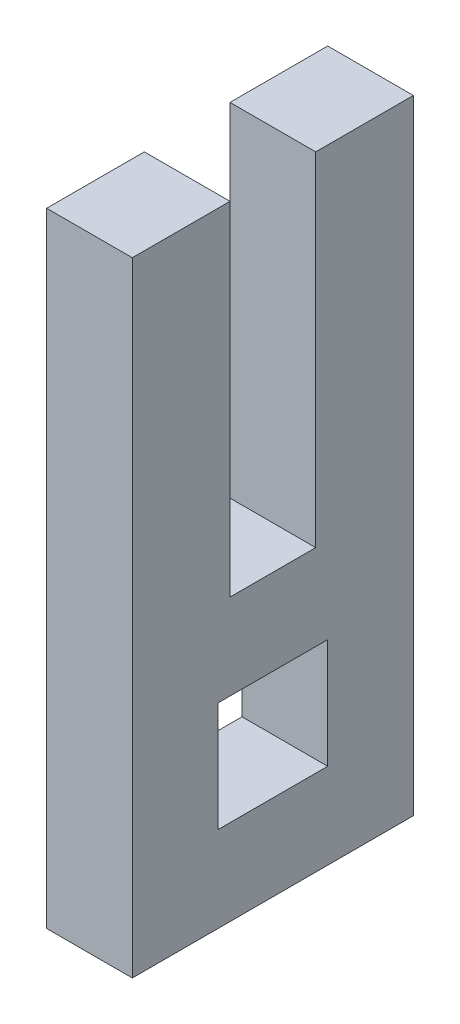
from build123d import *

# Parameters (mm, degrees)
SKETCH2_W           = 8.128
SKETCH2_H           = 8.128
BOSS_EXTRUDE1_DEPTH = 6.35


with BuildPart() as part:
    # Sketch2 → Boss-Extrude1 (new body)
    with BuildSketch(Plane(origin=(0, 0, 0), x_dir=(0, 0, -1), z_dir=(1, 0, 0))):
        Polygon((0, 0), (0, 46.228), (7.239, 46.228), (7.239, 20.828), (13.589, 20.828), (13.589, 46.228), (20.828, 46.228), (20.828, 0), align=None)
        with Locations((10.414, 10.414)):
            Rectangle(SKETCH2_W, SKETCH2_H, mode=Mode.SUBTRACT)
    extrude(amount=BOSS_EXTRUDE1_DEPTH)


solid = part.part
